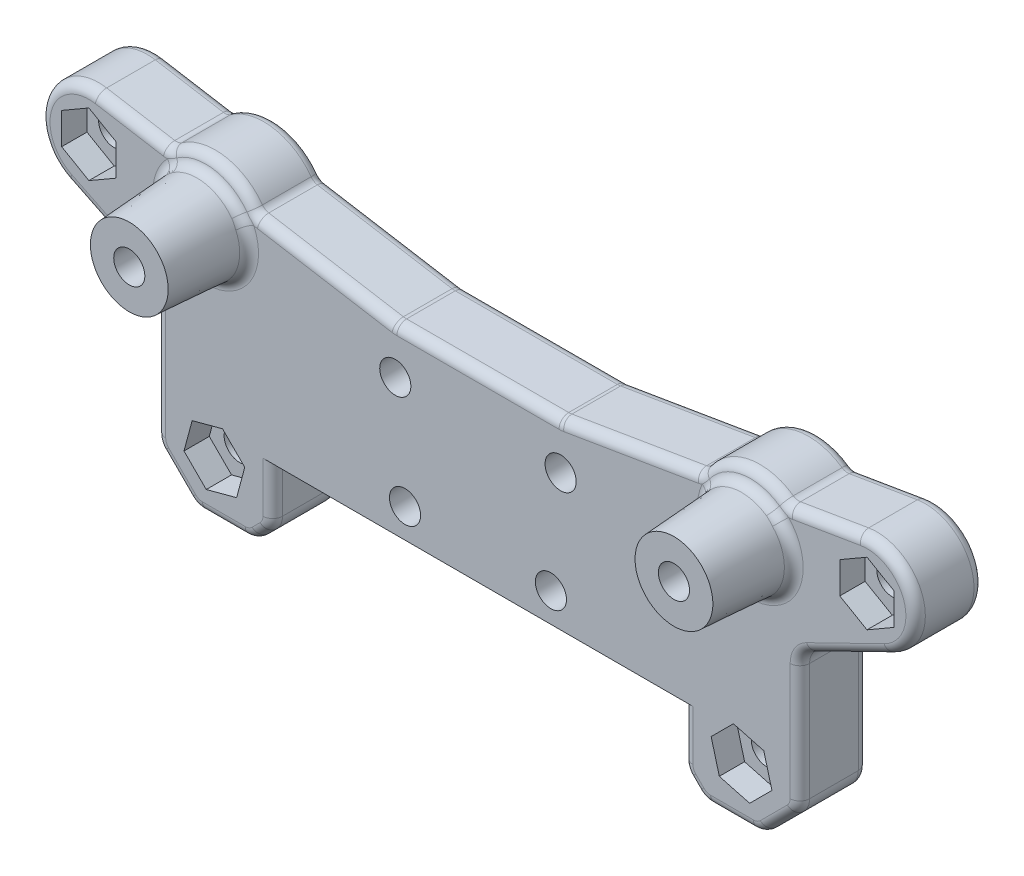
from build123d import *
from build123d.topology import SkipClean

# Parameters (mm, degrees)
ESQUISSE1_R             = 1.6
BOSS_EXTRU_1_DEPTH      = 7
CONG_1_R                = 1
CONG_2_R                = 1
ENL_V_MAT_EXTRU_1_DEPTH = 2.6
ENL_V_MAT_EXTRU_2_DEPTH = 2.6
CONG_2_OF_SYM_TRIE2_R   = 1


with BuildPart() as part:
    # Esquisse1 → Boss.-Extru.1 (new body)
    with BuildSketch(Plane.XY):
        with BuildLine():
            Line((21.1, 0), (21.1, -5.171572875))
            ThreePointArc((21.1, -5.171572875), (21.252240935, -5.93693974), (21.685786438, -6.585786438))
            Line((21.685786438, -6.585786438), (22.514213562, -7.414213562))
            ThreePointArc((22.514213562, -7.414213562), (23.16306026, -7.847759065), (23.928427125, -8))
            Line((23.928427125, -8), (28.321608891, -8))
            ThreePointArc((28.321608891, -8), (29.086975755, -7.847759065), (29.735822453, -7.414213562))
            Line((29.735822453, -7.414213562), (32.514213562, -4.635822453))
            ThreePointArc((32.514213562, -4.635822453), (32.947759065, -3.986975755), (33.1, -3.221608891))
            Line((33.1, -3.221608891), (33.1, 8.821797753))
            ThreePointArc((33.1, 8.821797753), (33.403903808, 9.881636281), (34.223257706, 10.619385845))
            Line((34.223257706, 10.619385845), (42.191899885, 14.505952322))
            ThreePointArc((42.191899885, 14.505952322), (44.761745411, 20.525353421), (39.172671247, 23.931163986))
            Line((39.172671247, 23.931163986), (31.747868766, 22.685454056))
            ThreePointArc((31.747868766, 22.685454056), (27.007214951, 23.917294808), (22.928175988, 21.205713835))
            Line((22.928175988, 21.205713835), (8.664315865, 18.812568397))
            ThreePointArc((8.664315865, 18.812568397), (8.499424852, 18.791904016), (8.333387515, 18.785))
            Line((8.333387515, 18.785), (-8.333387515, 18.785))
            ThreePointArc((-8.333387515, 18.785), (-8.499424852, 18.791904016), (-8.664315865, 18.812568397))
            Line((-8.664315865, 18.812568397), (-22.928175988, 21.205713835))
            ThreePointArc((-22.928175988, 21.205713835), (-27.007214951, 23.917294808), (-31.747868766, 22.685454056))
            Line((-31.747868766, 22.685454056), (-39.172671247, 23.931163986))
            ThreePointArc((-39.172671247, 23.931163986), (-44.761745411, 20.525353421), (-42.191899885, 14.505952322))
            Line((-42.191899885, 14.505952322), (-34.223257706, 10.619385845))
            ThreePointArc((-34.223257706, 10.619385845), (-33.403903808, 9.881636281), (-33.1, 8.821797753))
            Line((-33.1, 8.821797753), (-33.1, -3.221608891))
            ThreePointArc((-33.1, -3.221608891), (-32.947759065, -3.986975755), (-32.514213562, -4.635822453))
            Line((-32.514213562, -4.635822453), (-29.735822453, -7.414213562))
            ThreePointArc((-29.735822453, -7.414213562), (-29.086975755, -7.847759065), (-28.321608891, -8))
            Line((-28.321608891, -8), (-23.928427125, -8))
            ThreePointArc((-23.928427125, -8), (-23.16306026, -7.847759065), (-22.514213562, -7.414213562))
            Line((-22.514213562, -7.414213562), (-21.685786438, -6.585786438))
            ThreePointArc((-21.685786438, -6.585786438), (-21.252240935, -5.93693974), (-21.1, -5.171572875))
            Line((-21.1, -5.171572875), (-21.1, 0))
            Line((-21.1, 0), (21.1, 0))
        make_face()
        with Locations((27.1, -2.585786438)):
            Circle(ESQUISSE1_R, mode=Mode.SUBTRACT)
        with Locations((8.5, 14)):
            Circle(ESQUISSE1_R, mode=Mode.SUBTRACT)
        with Locations((7.5, 3)):
            Circle(ESQUISSE1_R, mode=Mode.SUBTRACT)
        with Locations((28, 18)):
            Circle(ESQUISSE1_R, mode=Mode.SUBTRACT)
        with Locations((40.000006378, 19)):
            Circle(ESQUISSE1_R, mode=Mode.SUBTRACT)
        with Locations((-40.000006378, 19)):
            Circle(ESQUISSE1_R, mode=Mode.SUBTRACT)
        with Locations((-28, 18)):
            Circle(ESQUISSE1_R, mode=Mode.SUBTRACT)
        with Locations((-7.5, 3)):
            Circle(ESQUISSE1_R, mode=Mode.SUBTRACT)
        with Locations((-8.5, 14)):
            Circle(ESQUISSE1_R, mode=Mode.SUBTRACT)
        with Locations((-27.1, -2.585786438)):
            Circle(ESQUISSE1_R, mode=Mode.SUBTRACT)
    extrude(amount=BOSS_EXTRU_1_DEPTH)

    # Congé1
    cong_1_edges = [part.edges().sort_by_distance(p)[0] for p in [
        (21.1, -2.585786438, 0),
        (21.252240935, -5.93693974, 0),
        (22.1, -7, 0),
        (23.16306026, -7.847759065, 0),
        (26.125018008, -8, 0),
        (29.086975755, -7.847759065, 0),
        (31.125018008, -6.025018008, 0),
        (32.947759065, -3.986975755, 0),
        (33.1, 2.800094431, 0),
        (33.403903808, 9.881636281, 0),
        (38.207578796, 12.562669084, 0),
        (44.761745411, 20.525353421, 0),
        (35.460270006, 23.308309021, 0),
        (8.499424852, 18.791904016, 0),
        (0, 18.785, 0),
        (21.1, -2.585786438, 7),
        (21.252240935, -5.93693974, 7),
        (22.1, -7, 7),
        (23.16306026, -7.847759065, 7),
        (26.125018008, -8, 7),
        (29.086975755, -7.847759065, 7),
        (31.125018008, -6.025018008, 7),
        (32.947759065, -3.986975755, 7),
        (33.1, 2.800094431, 7),
        (33.403903808, 9.881636281, 7),
        (38.207578796, 12.562669084, 7),
        (44.761745411, 20.525353421, 7),
        (35.460270006, 23.308309021, 7),
        (8.499424852, 18.791904016, 7),
        (0, 18.785, 7),
        (15.796245927, 20.009141116, 0),
        (15.796245927, 20.009141116, 7),
        (27.007214951, 23.917294808, 0),
        (27.007214951, 23.917294808, 7),
        (-21.1, -2.585786438, 7),
        (-21.1, -2.585786438, 0),
        (-21.252240935, -5.93693974, 7),
        (-21.252240935, -5.93693974, 0),
        (-22.1, -7, 7),
        (-22.1, -7, 0),
        (-23.16306026, -7.847759065, 7),
        (-23.16306026, -7.847759065, 0),
        (-26.125018008, -8, 7),
        (-26.125018008, -8, 0),
        (-29.086975755, -7.847759065, 7),
        (-29.086975755, -7.847759065, 0),
        (-31.125018008, -6.025018008, 7),
        (-31.125018008, -6.025018008, 0),
        (-32.947759065, -3.986975755, 7),
        (-32.947759065, -3.986975755, 0),
        (-33.1, 2.800094431, 7),
        (-33.1, 2.800094431, 0),
        (-33.403903808, 9.881636281, 7),
        (-33.403903808, 9.881636281, 0),
        (-38.207578796, 12.562669084, 7),
        (-38.207578796, 12.562669084, 0),
        (-8.499424852, 18.791904016, 7),
        (-8.499424852, 18.791904016, 0),
        (-44.761745411, 20.525353421, 7),
        (-44.761745411, 20.525353421, 0),
        (-15.796245927, 20.009141116, 7),
        (-15.796245927, 20.009141116, 0),
        (-35.460270006, 23.308309021, 7),
        (-35.460270006, 23.308309021, 0),
        (-22.928175988, 21.205713835, 3.5),
        (-27.007214951, 23.917294808, 7),
        (-31.747868766, 22.685454056, 3.5),
        (-27.007214951, 23.917294808, 0),
        (31.747868766, 22.685454056, 3.5),
        (22.928175988, 21.205713835, 3.5),
    ]]
    fillet(cong_1_edges, radius=CONG_1_R)

    # Esquisse5 → Révolution1 (revolve)
    with BuildSketch(Plane(origin=(28, 0, 0), x_dir=(0, 0, -1), z_dir=(1, 0, 0))):
        Polygon((-14.85, 19.6), (-14.85, 22), (-7, 22.5), (-7, 19.6), align=None)
    r_volution1 = revolve(axis=Axis((28, 18, 6.828217481), (0, 0, 1)))

    # Congé2
    cong_2_edges = [part.edges().sort_by_distance(p)[0] for p in [
        (28, 13.5, 7),
    ]]
    fillet(cong_2_edges, radius=CONG_2_R)

    # Esquisse3 → Enlèv. mat.-Extru.1 (cut)
    with BuildSketch(Plane.XY.offset(7)):
        Polygon((42.800006378, 17.383419246), (42.800006378, 20.616580754), (40.000006378, 22.233161507), (37.200006378, 20.616580754), (37.200006378, 17.383419246), (40.000006378, 15.766838493), align=None)
        Polygon((30.222994201, -3.422590212), (29.386190427, -0.299596011), (26.263196226, 0.537207763), (23.977005799, -1.748982664), (24.813809573, -4.871976864), (27.936803774, -5.708780638), align=None)
    enl_v_mat_extru_1 = extrude(amount=-ENL_V_MAT_EXTRU_1_DEPTH, mode=Mode.SUBTRACT)

    # Esquisse4 → Enlèv. mat.-Extru.2 (cut)
    with BuildSketch(Plane(origin=(0, 0, 0), x_dir=(-1, 0, 0), z_dir=(0, 0, -1))):
        Polygon((-24.811405033, 17.465027599), (-25.942402827, 20.493918043), (-29.130997794, 21.028890444), (-31.188594967, 18.534972401), (-30.057597173, 15.506081957), (-26.869002206, 14.971109556), align=None)
    enl_v_mat_extru_2 = extrude(amount=-ENL_V_MAT_EXTRU_2_DEPTH, mode=Mode.SUBTRACT)

    # Symétrie2: Révolution1, Enlèv. mat.-Extru.1, Enlèv. mat.-Extru.2 across plane
    with SkipClean():  # the faces are left unmerged after this step: merging them gives an invalid solid
        add(r_volution1.mirror(Plane(origin=(0, 0, 0), x_dir=(0, 0, 1), z_dir=(1, 0, 0))))
        add(enl_v_mat_extru_1.mirror(Plane(origin=(0, 0, 0), x_dir=(0, 0, 1), z_dir=(1, 0, 0))), mode=Mode.SUBTRACT)
        add(enl_v_mat_extru_2.mirror(Plane(origin=(0, 0, 0), x_dir=(0, 0, 1), z_dir=(1, 0, 0))), mode=Mode.SUBTRACT)
    add(part.part.scale(1), mode=Mode.REPLACE)  # the faces are merged on a copy

    # Congé2 of Symétrie2
    cong_2_of_sym_trie2_edges = [part.edges().sort_by_distance(p)[0] for p in [
        (-28, 13.5, 7),
    ]]
    fillet(cong_2_of_sym_trie2_edges, radius=CONG_2_OF_SYM_TRIE2_R)


solid = part.part
